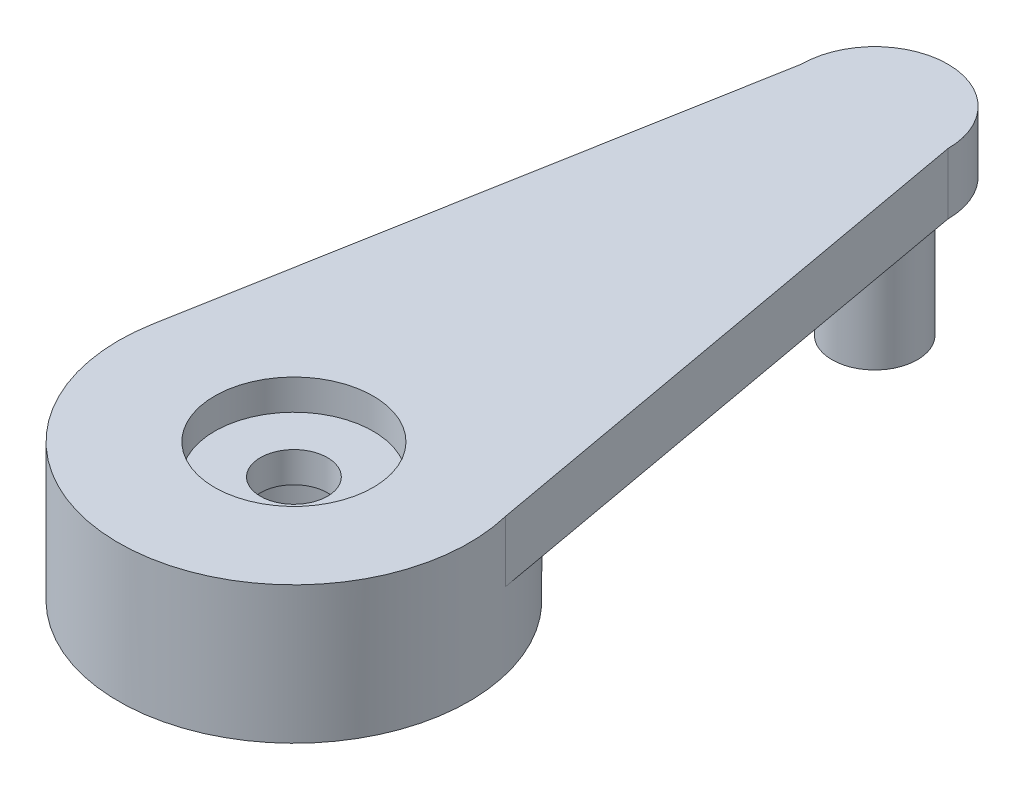
from build123d import *

# Parameters (mm, degrees)
SKETCH1_R           = 2.6
BOSS_EXTRUDE1_DEPTH = 2
SKETCH1_4_R         = 2.6
SKETCH1_4_R_2       = 1.1
BOSS_EXTRUDE2_DEPTH = 1
SKETCH1_6_R         = 1.4
BOSS_EXTRUDE5_DEPTH = 4.5
BOSS_EXTRUDE6_START = 2.5
SKETCH3_R           = 2.6
BOSS_EXTRUDE6_DEPTH = 2.5


with BuildPart() as part:
    # Sketch1 → Boss-Extrude1 (new body)
    with BuildSketch(Plane(origin=(0, 0, 0), x_dir=(1, 0, 0), z_dir=(0, 1, 0))):
        with BuildLine():
            Line((42.364722471, -30.294136835), (39.174415609, -12.596499772))
            ThreePointArc((39.174415609, -12.596499772), (36.774415609, -10.196499772), (34.374415609, -12.596499772))
            Line((34.374415609, -12.596499772), (31.117677492, -30.624623336))
            ThreePointArc((31.117677492, -30.624623336), (36.944978362, -37.394321753), (42.364722471, -30.294136835))
        make_face()
        with Locations((36.776091554, -31.646802527)):
            Circle(SKETCH1_R, mode=Mode.SUBTRACT)
    extrude(amount=BOSS_EXTRUDE1_DEPTH)

    # Sketch1<4> → Boss-Extrude2 (add)
    with BuildSketch(Plane(origin=(0, 0, 0), x_dir=(1, 0, 0), z_dir=(0, 1, 0))):
        with Locations((36.776091554, -31.646802527)):
            Circle(SKETCH1_4_R)
        with Locations((36.776091554, -31.646802527)):
            Circle(SKETCH1_4_R_2, mode=Mode.SUBTRACT)
    extrude(amount=BOSS_EXTRUDE2_DEPTH)

    # Sketch1<6> → Boss-Extrude5 (add)
    with BuildSketch(Plane(origin=(0, 0, 0), x_dir=(1, 0, 0), z_dir=(0, 1, 0))):
        with Locations((36.774415609, -12.596499772)):
            Circle(SKETCH1_6_R)
    extrude(amount=-BOSS_EXTRUDE5_DEPTH)

    # Sketch3 → Boss-Extrude6 (add)
    with BuildSketch(Plane.XZ.offset(BOSS_EXTRUDE6_START)):
        with BuildLine():
            ThreePointArc((42.364722471, 30.294136835), (42.48560676, 30.965673968), (42.526091554, 31.646802527))
            ThreePointArc((42.526091554, 31.646802527), (36.262954564, 37.373860274), (31.117677492, 30.624623336))
            ThreePointArc((31.117677492, 30.624623336), (36.607204747, 25.899283302), (42.364722471, 30.294136835))
        make_face()
        with Locations((36.776091554, 31.646802527)):
            Circle(SKETCH3_R, mode=Mode.SUBTRACT)
    extrude(amount=-BOSS_EXTRUDE6_DEPTH)


solid = part.part
